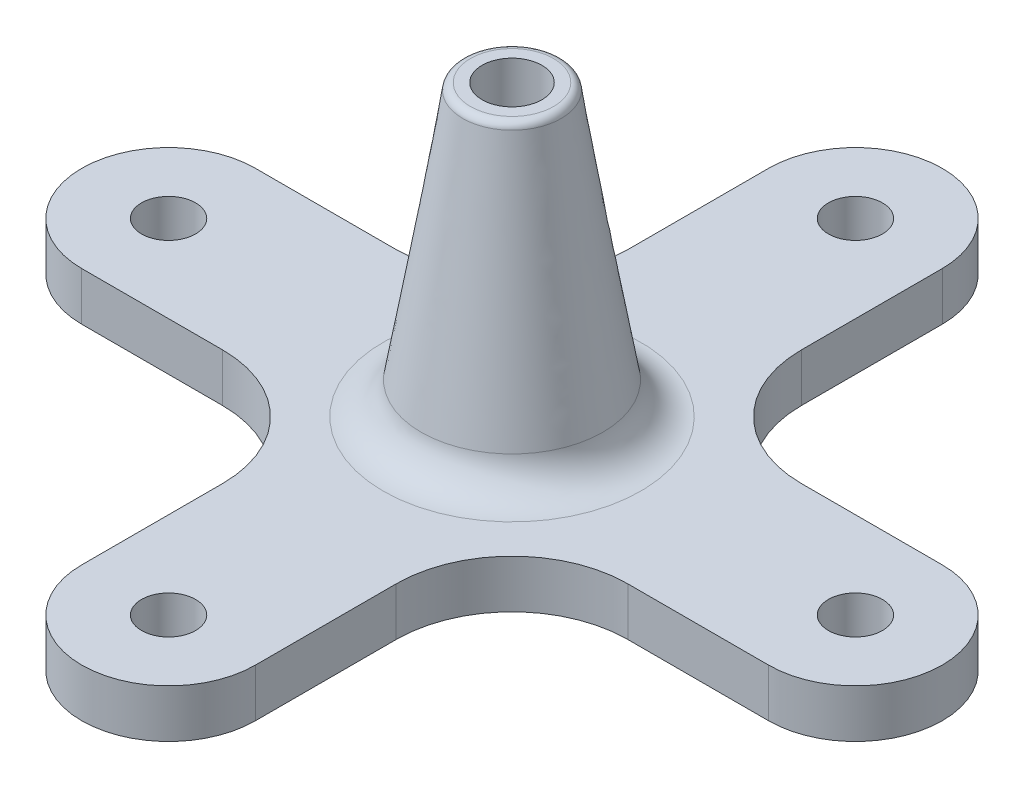
from build123d import *

# Parameters (mm, degrees)
BOSS_EXTRUDE1_DEPTH = 3.175
FILLET1_R           = 7.62
FILLET2_R           = 2.54
SKETCH4_R           = 1.9685
CUT_EXTRUDE1_DEPTH  = 19.05
FILLET3_R           = 0.508
SKETCH6_R           = 1.778
CUT_EXTRUDE2_DEPTH  = 3.175


with BuildPart() as part:
    # Sketch1 → Boss-Extrude1 (new body)
    with BuildSketch(Plane(origin=(0, 0, 0), x_dir=(1, 0, 0), z_dir=(0, 1, 0))):
        with BuildLine():
            Line((-22.606, 5.715), (22.606, 5.715))
            ThreePointArc((22.606, 5.715), (28.321, 0), (22.606, -5.715))
            Line((22.606, -5.715), (-22.606, -5.715))
            ThreePointArc((-22.606, -5.715), (-28.321, 0), (-22.606, 5.715))
        make_face()
        with BuildLine():
            Line((-5.715, -22.606), (-5.715, 22.606))
            ThreePointArc((-5.715, 22.606), (0, 28.321), (5.715, 22.606))
            Line((5.715, 22.606), (5.715, -22.606))
            ThreePointArc((5.715, -22.606), (0, -28.321), (-5.715, -22.606))
        make_face()
    extrude(amount=BOSS_EXTRUDE1_DEPTH)

    # Fillet1
    fillet1_edges = [part.edges().sort_by_distance(p)[0] for p in [
        (-5.715, 1.5875, -5.715),
        (-5.715, 1.5875, 5.715),
        (5.715, 1.5875, -5.715),
        (5.715, 1.5875, 5.715),
    ]]
    fillet(fillet1_edges, radius=FILLET1_R)

    # Loft1: read off the stored shape, not the designer's step
    # Loft1: loft between two sections, ruled curve by curve
    loft1_from = [
        Edge.make_bspline([(-2.865050686, 3.175, -5.666920201), (-14.198891088, 3.175, 0.063181171), (-8.468789716, 3.175, 11.397021573), (2.865050686, 3.175, 5.666920201), (14.198891088, 3.175, -0.063181171), (8.468789716, 3.175, -11.397021573), (-2.865050686, 3.175, -5.666920201)], [0, 0, 0, 0, 0.5, 0.5, 0.5, 1, 1, 1, 1], 3, [1, 0.333333333, 0.333333333, 1, 0.333333333, 0.333333333, 1]),
    ]
    loft1_to = [
        Edge.make_bspline([(-2.270310983, 22.225, -2.219529914), (-6.709370811, 22.225, 2.321092053), (-2.168748845, 22.225, 6.760151881), (2.270310983, 22.225, 2.219529914), (6.709370811, 22.225, -2.321092053), (2.168748845, 22.225, -6.760151881), (-2.270310983, 22.225, -2.219529914)], [0, 0, 0, 0, 0.5, 0.5, 0.5, 1, 1, 1, 1], 3, [1, 0.333333333, 0.333333333, 1, 0.333333333, 0.333333333, 1]),
    ]
    loft1 = Solid(Shell([*[Face.make_surface_from_curves(loft1_from[k], loft1_to[k]) for k in range(1)], Face(Wire(loft1_from)), Face(Wire(loft1_to))]))
    add(loft1)

    # Fillet2
    fillet2_edges = [part.edges().sort_by_distance(p)[0] for p in [
        (2.865050686, 3.175, 5.666920201),
    ]]
    fillet(fillet2_edges, radius=FILLET2_R)

    # Sketch4 → Cut-Extrude1 (cut)
    with BuildSketch(Plane(origin=(0, 22.225, 0), x_dir=(1, 0, 0), z_dir=(0, 1, 0))):
        with Locations(Location((0, 0, 0), (0, 0, 270))):
            Circle(SKETCH4_R)
    extrude(amount=-CUT_EXTRUDE1_DEPTH, mode=Mode.SUBTRACT)

    # Fillet3
    fillet3_edges = [part.edges().sort_by_distance(p)[0] for p in [
        (2.270310983, 22.225, 2.219529914),
    ]]
    fillet(fillet3_edges, radius=FILLET3_R)

    # Sketch6 → Cut-Extrude2 (cut)
    with BuildSketch(Plane(origin=(0, 3.175, 0), x_dir=(1, 0, 0), z_dir=(0, 1, 0))):
        with Locations(Location((-22.606, 0, 0), (0, 0, 270))):
            Circle(SKETCH6_R)
        with Locations(Location((22.606, 0, 0), (0, 0, 270))):
            Circle(SKETCH6_R)
        with Locations(Location((0, 22.606, 0), (0, 0, 270))):
            Circle(SKETCH6_R)
        with Locations(Location((0, -22.606, 0), (0, 0, 270))):
            Circle(SKETCH6_R)
    extrude(amount=-CUT_EXTRUDE2_DEPTH, mode=Mode.SUBTRACT)


solid = part.part
